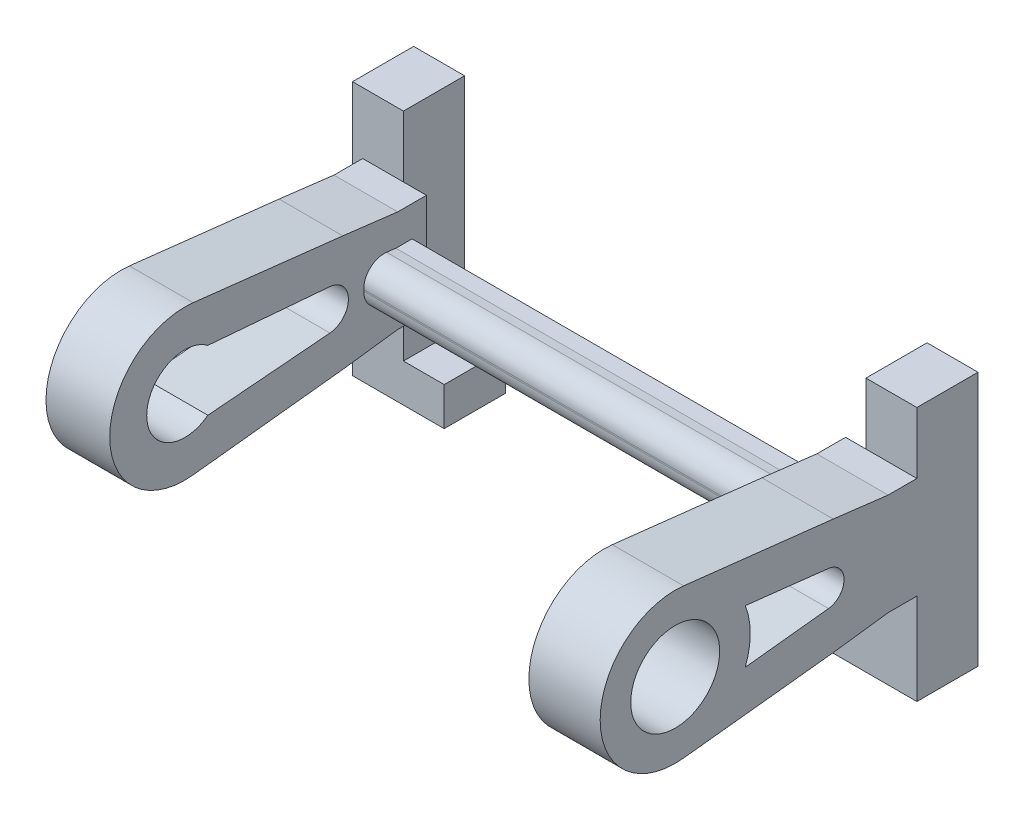
from build123d import *
from build123d.topology import SkipClean

# Parameters (mm, degrees)
SKETCH1_W                   = 45
SKETCH1_H                   = 20.5
SKETCH1_R                   = 1.05
BOSS_EXTRUDE1_DEPTH         = 1.75
SKETCH3_W                   = 1.5
SKETCH3_H                   = 22
BOSS_EXTRUDE2_DEPTH         = 1.5
BOSS_EXTRUDE2_2_DEPTH       = 1.5
SKETCH4_W                   = 3
SKETCH4_H                   = 0.75
BOSS_EXTRUDE3_DEPTH         = 1
SKETCH5_W                   = 3
SKETCH5_H                   = 0.75
BOSS_EXTRUDE4_DEPTH         = 1
SKETCH6_W                   = 2.5
SKETCH6_H                   = 2
BOSS_EXTRUDE5_DEPTH         = 1
BODY_MOVE_COPY1_START       = 1.25
BODY_MOVE_COPY1_OUTLINE_W   = 45
BODY_MOVE_COPY1_OUTLINE_H   = 20.5
BODY_MOVE_COPY1_OUTLINE_R   = 1.05
BODY_MOVE_COPY1_DEPTH       = 0.5
BODY_MOVE_COPY1_START_2     = -0.5
BODY_MOVE_COPY1_2_OUTLINE_W = 45
BODY_MOVE_COPY1_2_OUTLINE_H = 20.5
BODY_MOVE_COPY1_2_OUTLINE_R = 1.05
BODY_MOVE_COPY1_2_DEPTH     = 0.5
SKETCH8_W                   = 1.5
SKETCH8_H                   = 4
BOSS_EXTRUDE7_DEPTH         = 2
SKETCH9_W                   = 47.4
SKETCH9_H                   = 4
BOSS_EXTRUDE8_DEPTH         = 1
BOSS_EXTRUDE9_DEPTH         = 3.256
BOSS_EXTRUDE10_DEPTH        = 3
SKETCH13_R                  = 4.3655
SKETCH13_R_2                = 3.3655
BOSS_EXTRUDE11_DEPTH        = 3
SKETCH16_R                  = 4.3655
SKETCH16_R_2                = 3.3655
BOSS_EXTRUDE12_DEPTH        = 3
SKETCH17_W                  = 5
SKETCH17_H                  = 22
BOSS_EXTRUDE13_DEPTH        = 3
BOSS_EXTRUDE14_START        = -44.4
BOSS_EXTRUDE14_OUTLINE_W    = 2
BOSS_EXTRUDE14_OUTLINE_H    = 4
BOSS_EXTRUDE14_DEPTH        = 42.9
FILLET1_R                   = 2
SKETCH20_W                  = 6
SKETCH20_H                  = 3
BOSS_EXTRUDE15_DEPTH        = 3
BOSS_EXTRUDE16_DEPTH        = 3
BOSS_EXTRUDE17_DEPTH        = 3
BOSS_EXTRUDE18_DEPTH        = 3
BOSS_EXTRUDE19_START        = -3.256
BOSS_EXTRUDE19_DEPTH        = 6.256
CUT_EXTRUDE1_DEPTH          = 6.256
BOSS_EXTRUDE21_START        = -3
SKETCH26_R                  = 3.3655
BOSS_EXTRUDE21_DEPTH        = 7
SKETCH27_R                  = 4.3655
SKETCH27_R_2                = 3.3655
CUT_EXTRUDE2_DEPTH          = 3
SKETCH28_R                  = 5.378785713
SKETCH28_R_2                = 3.3655
BOSS_EXTRUDE22_DEPTH        = 7
SKETCH29_R                  = 3.730648532
CUT_EXTRUDE3_DEPTH          = 7
SKETCH31_W                  = 45.4
SKETCH31_H                  = 4
CUT_EXTRUDE4_DEPTH          = 21.25
SKETCH32_W                  = 41.144
SKETCH32_H                  = 1.408973542
CUT_EXTRUDE5_DEPTH          = 13.032142153
SKETCH33_R                  = 4.3655
CUT_EXTRUDE6_DEPTH          = 10
SKETCH34_R                  = 7.3655
SKETCH34_R_2                = 4.3655
BOSS_EXTRUDE23_DEPTH        = 7
BOSS_EXTRUDE24_DEPTH        = 6.256


# Read off the part's stored shape, not the designer's step: Body-Move/Copy1, Boss-Extrude14
with BuildPart() as part:
    # Sketch1 → Boss-Extrude1 (new body)
    with BuildSketch(Plane.XY):
        Rectangle(SKETCH1_W, SKETCH1_H)
        with Locations((20.45, -8.2)):
            Circle(SKETCH1_R, mode=Mode.SUBTRACT)
        with Locations((-20.45, 8.2)):
            Circle(SKETCH1_R, mode=Mode.SUBTRACT)
    extrude(amount=BOSS_EXTRUDE1_DEPTH)

    # Body-Move/Copy1 outline → Body-Move/Copy1 (cut)
    with BuildSketch(Plane.XY.offset(BODY_MOVE_COPY1_START)):
        Rectangle(BODY_MOVE_COPY1_OUTLINE_W, BODY_MOVE_COPY1_OUTLINE_H)
        with Locations((20.45, -8.2)):
            Circle(BODY_MOVE_COPY1_OUTLINE_R, mode=Mode.SUBTRACT)
        with Locations((-20.45, 8.2)):
            Circle(BODY_MOVE_COPY1_OUTLINE_R, mode=Mode.SUBTRACT)
    extrude(amount=BODY_MOVE_COPY1_DEPTH, mode=Mode.SUBTRACT)

    # Body-Move_Copy1 2 outline → Body-Move_Copy1 2 (add)
    with BuildSketch(Plane.XY.offset(BODY_MOVE_COPY1_START_2)):
        Rectangle(BODY_MOVE_COPY1_2_OUTLINE_W, BODY_MOVE_COPY1_2_OUTLINE_H)
        with Locations((20.45, -8.2)):
            Circle(BODY_MOVE_COPY1_2_OUTLINE_R, mode=Mode.SUBTRACT)
        with Locations((-20.45, 8.2)):
            Circle(BODY_MOVE_COPY1_2_OUTLINE_R, mode=Mode.SUBTRACT)
    extrude(amount=BODY_MOVE_COPY1_2_DEPTH)


with BuildPart() as body_2:
    # Sketch3 → Boss-Extrude2 (new, symmetric)
    with BuildSketch(Plane(origin=(0, 0, 0), x_dir=(-1, 0, 0), z_dir=(0, 0, -1))):
        with Locations((-23.45, 0)):
            Rectangle(SKETCH3_W, SKETCH3_H)
    extrude(amount=BOSS_EXTRUDE2_DEPTH, both=True)

    # Sketch4 → Boss-Extrude3 (add)
    with BuildSketch(Plane.ZY.offset(-22.7)):
        with Locations((0, -10.625)):
            Rectangle(SKETCH4_W, SKETCH4_H)
    extrude(amount=BOSS_EXTRUDE3_DEPTH)



with BuildPart() as body_3:
    # Sketch3 → Boss-Extrude2 2 (new, symmetric)
    with BuildSketch(Plane(origin=(0, 0, 0), x_dir=(-1, 0, 0), z_dir=(0, 0, -1))):
        with Locations((23.45, 0)):
            Rectangle(SKETCH3_W, SKETCH3_H)
    extrude(amount=BOSS_EXTRUDE2_2_DEPTH, both=True)

    # Sketch5 → Boss-Extrude4 (add)
    with BuildSketch(Plane(origin=(-22.7, 0, 0), x_dir=(0, 0, -1), z_dir=(1, 0, 0))):
        with Locations((0, -10.625)):
            Rectangle(SKETCH5_W, SKETCH5_H)
    extrude(amount=BOSS_EXTRUDE4_DEPTH)


with BuildPart() as body_2_1:
    add(body_2.part)

    add(body_3.part)  # Boss-Extrude5 merges body 3
    # Sketch6 → Boss-Extrude5 (add)
    with BuildSketch(Plane(origin=(0, 0, -1.5), x_dir=(-1, 0, 0), z_dir=(0, 0, -1))):
        with Locations((-22.95, -10)):
            Rectangle(SKETCH6_W, SKETCH6_H)
        with Locations((22.95, -10)):
            Rectangle(SKETCH6_W, SKETCH6_H)
    extrude(amount=-BOSS_EXTRUDE5_DEPTH)

    # Sketch8 → Boss-Extrude7 (add)
    with BuildSketch(Plane.XY.offset(1.5)):
        with Locations((-22.95, -0.032142153)):
            Rectangle(SKETCH8_W, SKETCH8_H)
        with Locations((22.95, -0.032142153)):
            Rectangle(SKETCH8_W, SKETCH8_H)
    extrude(amount=BOSS_EXTRUDE7_DEPTH)

    # Sketch9 → Boss-Extrude8 (add)
    with BuildSketch(Plane.XY.offset(3.5)):
        with Locations((0, -0.032142153)):
            Rectangle(SKETCH9_W, SKETCH9_H)
    extrude(amount=BOSS_EXTRUDE8_DEPTH)

    # Sketch11 → Boss-Extrude9 (add)
    with BuildSketch(Plane.ZY.offset(23.7)):
        with BuildLine():
            Line((10.066137971, -2.750359304), (24.743901725, -4.371263733))
            ThreePointArc((24.743901725, -4.371263733), (29.588578443, -0.02623116), (24.732152942, 4.305665873))
            Line((24.732152942, 4.305665873), (10.058832491, 2.645019328))
            Line((10.058832491, 2.645019328), (4.5, 1.967857847))
            Line((4.5, 1.967857847), (4.5, -2.032142153))
            Line((4.5, -2.032142153), (10.066137971, -2.750359304))
        make_face()
        with BuildLine():
            ThreePointArc((24.853667095, -3.377306207), (28.588579359, -0.027585185), (24.844609591, 3.312009241))
            Line((24.844609591, 3.312009241), (10.17128914, 1.651362696))
            ThreePointArc((10.17128914, 1.651362696), (8.649597637, -0.054583074), (10.17590334, -1.756401778))
            Line((10.17590334, -1.756401778), (24.853667095, -3.377306207))
        make_face(mode=Mode.SUBTRACT)
    extrude(amount=-BOSS_EXTRUDE9_DEPTH)

    # Sketch12 → Boss-Extrude10 (add)
    with BuildSketch(Plane(origin=(23.7, 0, 0), x_dir=(0, 0, -1), z_dir=(1, 0, 0))):
        with BuildLine():
            Line((-24.732152942, 4.305665873), (-10.058832491, 2.645019328))
            Line((-10.058832491, 2.645019328), (-4.5, 1.967857847))
            Line((-4.5, 1.967857847), (-4.5, -2.032142153))
            Line((-4.5, -2.032142153), (-10.066137971, -2.750359304))
            Line((-10.066137971, -2.750359304), (-24.743901725, -4.371263733))
            ThreePointArc((-24.743901725, -4.371263733), (-29.588578443, -0.02623116), (-24.732152942, 4.305665873))
        make_face()
        with BuildLine():
            ThreePointArc((-10.17590334, -1.756401778), (-8.649597637, -0.054583074), (-10.17128914, 1.651362696))
            Line((-10.17128914, 1.651362696), (-24.844609591, 3.312009241))
            ThreePointArc((-24.844609591, 3.312009241), (-28.588579359, -0.027585185), (-24.853667095, -3.377306207))
            Line((-24.853667095, -3.377306207), (-10.17590334, -1.756401778))
        make_face(mode=Mode.SUBTRACT)
    extrude(amount=-BOSS_EXTRUDE10_DEPTH)

    # Sketch13 → Boss-Extrude11 (add)
    with BuildSketch(Plane(origin=(23.7, 0, 0), x_dir=(0, 0, -1), z_dir=(1, 0, 0))):
        with Locations((-25.223082444, -0.032142153)):
            Circle(SKETCH13_R)
        with Locations((-25.223082444, -0.032142153)):
            Circle(SKETCH13_R_2, mode=Mode.SUBTRACT)
    extrude(amount=-BOSS_EXTRUDE11_DEPTH)

    # Sketch16 → Boss-Extrude12 (add)
    with BuildSketch(Plane.ZY.offset(-20.7)):
        with Locations(Location((25.223082444, -0.032142153, 0), (0, 0, 136.019369677))):
            Circle(SKETCH16_R)
        with Locations(Location((25.223082444, -0.032142153, 0), (0, 0, 180))):
            Circle(SKETCH16_R_2, mode=Mode.SUBTRACT)
    extrude(amount=BOSS_EXTRUDE12_DEPTH)

    # Sketch17 → Boss-Extrude13 (add)
    with BuildSketch(Plane(origin=(0, 0, -1.5), x_dir=(-1, 0, 0), z_dir=(0, 0, -1))):
        with Locations((-25.2, 0)):
            Rectangle(SKETCH17_W, SKETCH17_H)
        with Locations((25.2, 0)):
            Rectangle(SKETCH17_W, SKETCH17_H)
    extrude(amount=-BOSS_EXTRUDE13_DEPTH)

    # Boss-Extrude14 outline → Boss-Extrude14 (add)
    with BuildSketch(Plane.ZY.offset(23.7).offset(BOSS_EXTRUDE14_START)):
        with Locations((2.5, -0.032142153)):
            Rectangle(BOSS_EXTRUDE14_OUTLINE_W, BOSS_EXTRUDE14_OUTLINE_H)
        with BuildLine():
            Line((10.012890898, 2.639422851), (4.5, 1.967857847))
            Line((4.5, 1.967857847), (4.5, -2.032142153))
            Line((4.5, -2.032142153), (9.967409055, -2.737619986))
            ThreePointArc((9.967409055, -2.737619986), (7.649693167, -0.029301759), (10.012890898, 2.639422851))
        make_face()
    extrude(amount=BOSS_EXTRUDE14_DEPTH)

    # Fillet1
    # the kernel refuses this fillet: 2 mm, written as the material it takes off along each edge
    with BuildSketch(Plane(origin=(20.7, -2.737619986, 9.967409055), x_dir=(0, 0.7492110038942702, -0.6623313911054948), z_dir=(-1, 0, 0))) as fillet1_piece_1:
        with BuildLine():
            CenterArc((4.787077901, 1.529415678), FILLET1_R, 131.16964068, 98.711366411)
            Line((3.47049653, 3.034943324), (0, 0))
            ThreePointArc((0, 0), (1.749161793, 0.638700571), (3.498323587, 0))
        make_face()
    extrude(amount=41.144, mode=Mode.SUBTRACT)
    with BuildSketch(Plane(origin=(20.7, 2.639422851, 10.012890898), x_dir=(0, -0.7411764808079845, -0.6713102295489705), z_dir=(-1, 0, 0))) as fillet1_piece_2:
        with BuildLine():
            CenterArc((4.814675065, -1.523124197), FILLET1_R, 130.397896763, 98.715764742)
            Line((3.505553923, -3.035143323), (0, 0))
            ThreePointArc((0, 0), (1.759245587, -0.647239684), (3.518491173, 0))
        make_face()
    extrude(amount=41.144, mode=Mode.SUBTRACT)

    # Sketch20 → Boss-Extrude15 (add)
    with BuildSketch(Plane.XZ.offset(11)):
        with Locations((-24.7, 0)):
            Rectangle(SKETCH20_W, SKETCH20_H)
        with Locations((24.7, 0)):
            Rectangle(SKETCH20_W, SKETCH20_H)
    extrude(amount=BOSS_EXTRUDE15_DEPTH)

    # Sketch21 → Boss-Extrude16 (add)
    with BuildSketch(Plane(origin=(0, 0, -1.5), x_dir=(-1, 0, 0), z_dir=(0, 0, -1))):
        Polygon((-21.7, -9), (-22.7, -9), (-22.7, 11), (-27.7, 11), (-27.7, -14), (-21.7, -14), align=None)
        Polygon((21.7, -9), (21.7, -14), (27.7, -14), (27.7, 11), (22.7, 11), (22.7, -9), align=None)
    extrude(amount=BOSS_EXTRUDE16_DEPTH)

    # Sketch22 → Boss-Extrude17 (add)
    with BuildSketch(Plane.ZY.offset(-21.7)):
        Polygon((1.5, -14), (1.5, -10.25), (-0.5, -10.25), (-0.5, -9), (-4.5, -9), (-4.5, -14), align=None)
    extrude(amount=BOSS_EXTRUDE17_DEPTH)

    # Sketch23 → Boss-Extrude18 (add)
    with BuildSketch(Plane(origin=(-21.7, 0, 0), x_dir=(0, 0, -1), z_dir=(1, 0, 0))):
        Polygon((-1.5, -10.25), (-1.5, -14), (4.5, -14), (4.5, -9), (0.5, -9), (0.5, -10.25), align=None)
    extrude(amount=BOSS_EXTRUDE18_DEPTH)

    # Sketch24 → Boss-Extrude19 (add)
    with SkipClean():  # the faces are left unmerged after this step: merging them gives an invalid solid
        with BuildSketch(Plane.ZY.offset(23.7).offset(BOSS_EXTRUDE19_START)):
            with BuildLine():
                Line((1.5, 4.967857847), (1.5, -5.032142153))
                Line((1.5, -5.032142153), (4.307249044, -5.032142153))
                Line((4.307249044, -5.032142153), (9.709501407, -5.729212603))
                Line((9.709501407, -5.729212603), (24.414605618, -7.353136312))
                ThreePointArc((24.414605618, -7.353136312), (32.588575693, -0.022169088), (24.394782994, 7.286635769))
                Line((24.394782994, 7.286635769), (9.708756206, 5.624551189))
                Line((9.708756206, 5.624551189), (4.317947084, 4.967857847))
                Line((4.317947084, 4.967857847), (1.5, 4.967857847))
            make_face()
            with BuildLine():
                Line((24.853667095, -3.377306207), (10.17590334, -1.756401778))
                ThreePointArc((10.17590334, -1.756401778), (8.649597637, -0.054583074), (10.17128914, 1.651362696))
                Line((10.17128914, 1.651362696), (24.844609591, 3.312009241))
                ThreePointArc((24.844609591, 3.312009241), (28.588579359, -0.027585185), (24.853667095, -3.377306207))
            make_face(mode=Mode.SUBTRACT)
        extrude(amount=BOSS_EXTRUDE19_DEPTH)

    # Sketch25 → Cut-Extrude1 (cut)
    with BuildSketch(Plane.ZY.offset(26.7)):
        with BuildLine():
            Line((24.732152942, 4.305665873), (10.058832491, 2.645019328))
            ThreePointArc((10.058832491, 2.645019328), (7.649598554, -0.055937098), (10.066137971, -2.750359304))
            Line((10.066137971, -2.750359304), (24.743901725, -4.371263733))
            ThreePointArc((24.743901725, -4.371263733), (29.588578443, -0.02623116), (24.732152942, 4.305665873))
        make_face()
        with BuildLine():
            ThreePointArc((10.17590334, -1.756401778), (8.649597637, -0.054583074), (10.17128914, 1.651362696))
            Line((10.17128914, 1.651362696), (24.844609591, 3.312009241))
            ThreePointArc((24.844609591, 3.312009241), (28.588579359, -0.027585185), (24.853667095, -3.377306207))
            Line((24.853667095, -3.377306207), (10.17590334, -1.756401778))
        make_face(mode=Mode.SUBTRACT)
    extrude(amount=-CUT_EXTRUDE1_DEPTH, mode=Mode.SUBTRACT)

    # Sketch26 → Boss-Extrude21 (add)
    with SkipClean():  # the faces are left unmerged after this step: merging them gives an invalid solid
        with BuildSketch(Plane(origin=(23.7, 0, 0), x_dir=(0, 0, -1), z_dir=(1, 0, 0)).offset(BOSS_EXTRUDE21_START)):
            with BuildLine():
                Line((-1.5, 4.967857847), (-4.317947084, 4.967857847))
                Line((-4.317947084, 4.967857847), (-9.708756206, 5.624551189))
                Line((-9.708756206, 5.624551189), (-24.394782994, 7.286635769))
                ThreePointArc((-24.394782994, 7.286635769), (-32.588575693, -0.022169088), (-24.414605618, -7.353136312))
                Line((-24.414605618, -7.353136312), (-9.709501407, -5.729212603))
                Line((-9.709501407, -5.729212603), (-4.307249044, -5.032142153))
                Line((-4.307249044, -5.032142153), (-1.5, -5.032142153))
                Line((-1.5, -5.032142153), (-1.5, 4.967857847))
            make_face()
            with BuildLine():
                ThreePointArc((-10.17128914, 1.651362696), (-8.649597637, -0.054583074), (-10.17590334, -1.756401778))
                Line((-10.17590334, -1.756401778), (-22.090000411, -3.072107156))
                ThreePointArc((-22.090000411, -3.072107156), (-20.857586446, -0.038053146), (-22.081779534, 2.999327173))
                Line((-22.081779534, 2.999327173), (-10.17128914, 1.651362696))
            make_face(mode=Mode.SUBTRACT)
            with Locations(Location((-25.223082444, -0.032142153, 0), (0, 0, 90))):
                Circle(SKETCH26_R, mode=Mode.SUBTRACT)
        extrude(amount=BOSS_EXTRUDE21_DEPTH)

    # Sketch27 → Cut-Extrude2 (cut)
    with SkipClean():  # the faces are left unmerged after this step: merging them gives an invalid solid
        with BuildSketch(Plane.ZY.offset(-17.7)):
            with Locations((25.223082444, -0.032142153)):
                Circle(SKETCH27_R)
            with Locations(Location((25.223082444, -0.032142153, 0), (0, 0, 180))):
                Circle(SKETCH27_R_2, mode=Mode.SUBTRACT)
        extrude(amount=-CUT_EXTRUDE2_DEPTH, mode=Mode.SUBTRACT)

    # Sketch28 → Boss-Extrude22 (add)
    with BuildSketch(Plane(origin=(27.7, 0, 0), x_dir=(0, 0, -1), z_dir=(1, 0, 0))):
        with Locations((-25.223082444, -0.032142153)):
            Circle(SKETCH28_R)
        with Locations((-25.223082444, -0.032142153)):
            Circle(SKETCH28_R_2, mode=Mode.SUBTRACT)
    extrude(amount=-BOSS_EXTRUDE22_DEPTH)

    # Sketch29 → Cut-Extrude3 (cut)
    with BuildSketch(Plane(origin=(27.7, 0, 0), x_dir=(0, 0, -1), z_dir=(1, 0, 0))):
        with Locations(Location((-25.223082444, -0.032142153, 0), (0, 0, 90))):
            Circle(SKETCH29_R)
    extrude(amount=-CUT_EXTRUDE3_DEPTH, mode=Mode.SUBTRACT)

    # Sketch31 → Cut-Extrude4 (cut)
    with BuildSketch(Plane(origin=(0, 11, 0), x_dir=(1, 0, 0), z_dir=(0, 1, 0))):
        with Locations((0, 0.5)):
            Rectangle(SKETCH31_W, SKETCH31_H)
    extrude(amount=-CUT_EXTRUDE4_DEPTH, mode=Mode.SUBTRACT)

    # Sketch32 → Cut-Extrude5 (cut)
    with BuildSketch(Plane(origin=(0, 11, 0), x_dir=(1, 0, 0), z_dir=(0, 1, 0))):
        with Locations((0.128, -2.204486771)):
            Rectangle(SKETCH32_W, SKETCH32_H)
    extrude(amount=-CUT_EXTRUDE5_DEPTH, mode=Mode.SUBTRACT)

    # Sketch33 → Cut-Extrude6 (cut)
    with BuildSketch(Plane.ZY.offset(-20.7)):
        with Locations((25.223082444, -0.032142153)):
            Circle(SKETCH33_R)
    extrude(amount=-CUT_EXTRUDE6_DEPTH, mode=Mode.SUBTRACT)

    # Sketch34 → Boss-Extrude23 (add)
    with BuildSketch(Plane.ZY.offset(-20.7)):
        with Locations((25.223082444, -0.032142153)):
            Circle(SKETCH34_R)
        with Locations((25.223082444, -0.032142153)):
            Circle(SKETCH34_R_2, mode=Mode.SUBTRACT)
    extrude(amount=-BOSS_EXTRUDE23_DEPTH)

    # Sketch35 → Boss-Extrude24 (add)
    with BuildSketch(Plane.ZY.offset(26.7)):
        with BuildLine():
            Line((10.058832491, 2.645019328), (24.732152942, 4.305665873))
            ThreePointArc((24.732152942, 4.305665873), (29.588578443, -0.02623116), (24.743901725, -4.371263733))
            Line((24.743901725, -4.371263733), (10.066137971, -2.750359304))
            ThreePointArc((10.066137971, -2.750359304), (7.649598554, -0.055937098), (10.058832491, 2.645019328))
        make_face()
        with BuildLine():
            ThreePointArc((22.957489609, -3.001538406), (28.958082444, -0.032142153), (22.957489609, 2.937254099))
            Line((22.957489609, 2.937254099), (10.974047703, 1.941051351))
            ThreePointArc((10.974047703, 1.941051351), (9.158082444, -0.032142153), (10.974047703, -2.005335657))
            Line((10.974047703, -2.005335657), (22.957489609, -3.001538406))
        make_face(mode=Mode.SUBTRACT)
    extrude(amount=-BOSS_EXTRUDE24_DEPTH)


solid = body_2_1.part
